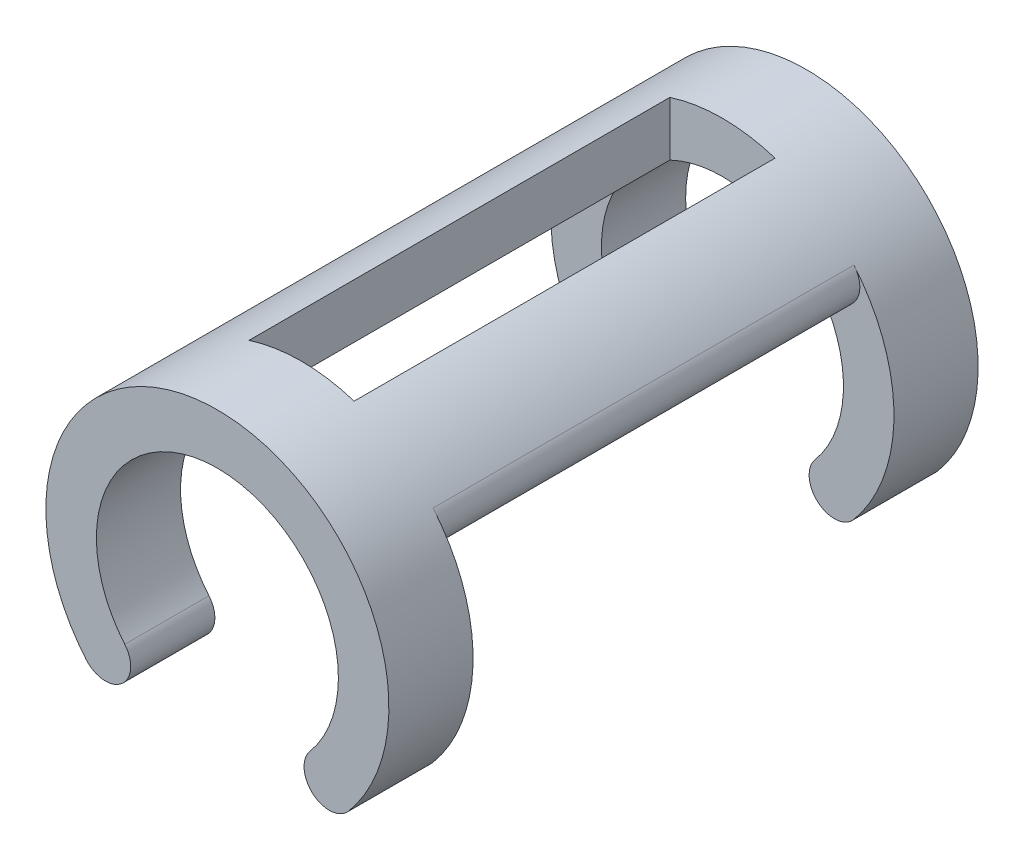
from build123d import *

# Parameters (mm, degrees)
SKETCH1_R               = 4.075
SKETCH1_R_2             = 2.875
BOSS_EXTRUDE1_DEPTH     = 7
CUT_EXTRUDE2_DEPTH      = 5
CUT_EXTRUDE2_DEPTH_BACK = 5
CUT_EXTRUDE3_DEPTH      = 10.067041965
CUT_EXTRUDE3_DEPTH_BACK = 10.067041965
FILLET2_R               = 0.6
CUT_EXTRUDE4_DEPTH      = 10.067041965
CUT_EXTRUDE4_DEPTH_BACK = 10.067041965
SKETCH6_W               = 2.5
SKETCH6_H               = 10


with BuildPart() as part:
    # Sketch1 → Boss-Extrude1 (new, symmetric)
    with BuildSketch(Plane.XY):
        Circle(SKETCH1_R)
        Circle(SKETCH1_R_2, mode=Mode.SUBTRACT)
    extrude(amount=BOSS_EXTRUDE1_DEPTH, both=True)

    # Sketch4 → Cut-Extrude2 (cut, two sides: drawn at the far end of the back side and taken through both)
    with BuildSketch(Plane(origin=(0, 0, 0), x_dir=(-1, 0, 0), z_dir=(0, 0, -1)).offset(-CUT_EXTRUDE2_DEPTH_BACK)):
        with BuildLine():
            Line((-3.52905352, 2.0375), (0, 0))
            Line((0, 0), (3.52905352, 2.0375))
            ThreePointArc((3.52905352, 2.0375), (0, -4.075), (-3.52905352, 2.0375))
        make_face()
    extrude(amount=CUT_EXTRUDE2_DEPTH + CUT_EXTRUDE2_DEPTH_BACK, mode=Mode.SUBTRACT)

    # Sketch5 → Cut-Extrude3 (cut, two sides: drawn at the far end of the back side and taken through both)
    with BuildSketch(Plane(origin=(0, 0, 0), x_dir=(-1, 0, 0), z_dir=(0, 0, -1)).offset(-CUT_EXTRUDE3_DEPTH_BACK)):
        with BuildLine():
            Line((-2.619359509, -3.121631106), (0, 0))
            Line((0, 0), (2.619359509, -3.121631106))
            ThreePointArc((2.619359509, -3.121631106), (0, -4.075), (-2.619359509, -3.121631106))
        make_face()
    extrude(amount=CUT_EXTRUDE3_DEPTH + CUT_EXTRUDE3_DEPTH_BACK, mode=Mode.SUBTRACT)

    # Fillet2
    fillet2_edges = [part.edges().sort_by_distance(p)[0] for p in [
        (-3.52905352, 2.0375, 0),
        (-2.489823036, 1.4375, 0),
        (3.52905352, 2.0375, 0),
        (2.489823036, 1.4375, 0),
        (-2.619359509, -3.121631106, 6),
        (-1.848014378, -2.202377774, 6),
        (2.619359509, -3.121631106, 6),
        (1.848014378, -2.202377774, 6),
        (-2.619359509, -3.121631106, -6),
        (-1.848014378, -2.202377774, -6),
        (1.848014378, -2.202377774, -6),
        (2.619359509, -3.121631106, -6),
    ]]
    fillet(fillet2_edges, radius=FILLET2_R - 0.0001)  # a hair under: the kernel refuses the full size

    # Sketch6 → Cut-Extrude4 (cut, two sides: drawn at the far end of the back side and taken through both)
    with BuildSketch(Plane(origin=(0, 0, 0), x_dir=(1, 0, 0), z_dir=(0, 1, 0)).offset(-CUT_EXTRUDE4_DEPTH_BACK)):
        Rectangle(SKETCH6_W, SKETCH6_H)
    extrude(amount=CUT_EXTRUDE4_DEPTH + CUT_EXTRUDE4_DEPTH_BACK, mode=Mode.SUBTRACT)


solid = part.part
